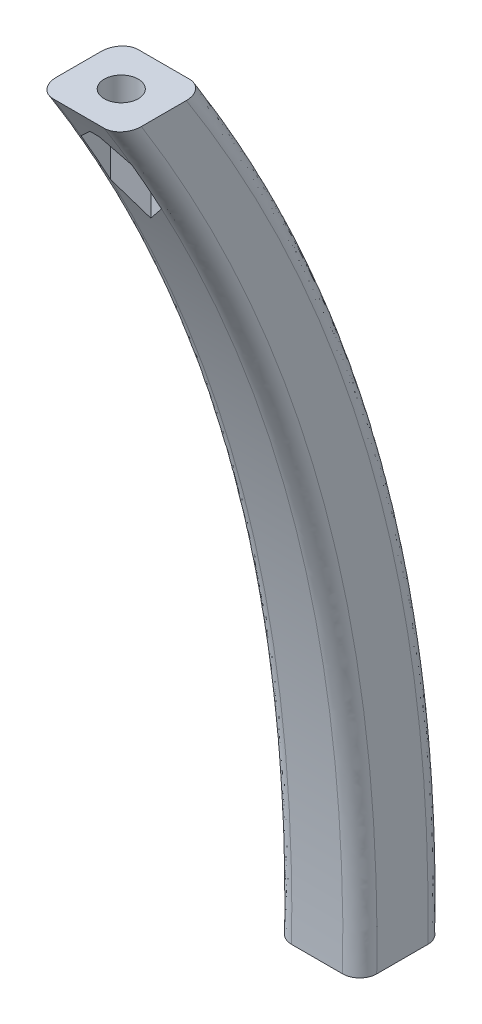
from build123d import *

# Parameters (mm, degrees)
SWEEP1_START          = -5
SWEEP1_DEPTH          = 10
CUT_EXTRUDE1_DEPTH    = 103.581674908
F_4_0MM_DOWEL_HOLE1_D = 4
FILLET2_R             = 2


# Read off the part's stored shape, not the designer's step: Sweep1
with BuildPart() as part:
    # Sweep1 outline → Sweep1 (new body)
    with BuildSketch(Plane.YZ.offset(SWEEP1_START)):
        with BuildLine():
            add(Edge.make_bspline(
                [(0, 5), (36.047601353, 4.409009522), (69.380934685, 13.742342856), (100, 33)],
                knots=[0, 0, 0, 0, 1, 1, 1, 1], degree=3))
            Line((0, 5), (0, -5))
            add(Edge.make_bspline(
                [(0, -5), (36.047601353, -5.590990478), (69.380934685, 3.742342856), (100, 23)],
                knots=[0, 0, 0, 0, 1, 1, 1, 1], degree=3))
            Line((100, 23), (100, 33))
        make_face()
    extrude(amount=SWEEP1_DEPTH)

    # Sketch3 → Cut-Extrude1 (cut, through all)
    with BuildSketch(Plane(origin=(0, 97, 0), x_dir=(1, 0, 0), z_dir=(0, 1, 0))):
        Polygon((0, -24.535898385), (-3, -26.267949192), (-3, -29.732050808), (0, -31.464101615), (3, -29.732050808), (3, -26.267949192), align=None)
    extrude(amount=-CUT_EXTRUDE1_DEPTH, mode=Mode.SUBTRACT)

    # Ø4.0mm Dowel Hole1 (through all)
    with Locations(Plane(origin=(0, 97, 0), x_dir=(-1, 0, 0), z_dir=(0, -1, 0))):
        with Locations((0, -28)):
            Hole(F_4_0MM_DOWEL_HOLE1_D / 2)

    # Fillet2
    fillet2_edges = [part.edges().sort_by_distance(p)[0] for p in [
        (-5, 52.035701014, 11.556757142),
        (5, 52.035701014, 11.556757142),
        (-5, 52.035701014, 1.556757142),
        (5, 52.035701014, 1.556757142),
    ]]
    fillet(fillet2_edges, radius=FILLET2_R - 0.0001)  # a hair under: the kernel refuses the full size


solid = part.part
